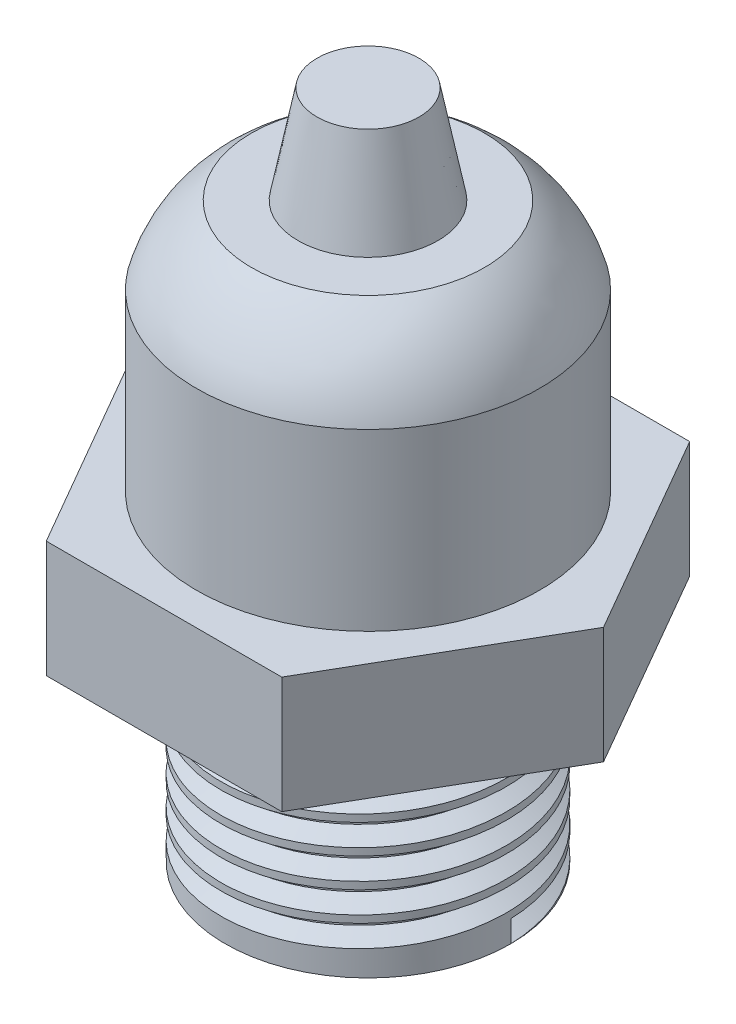
from build123d import *

# Parameters (mm, degrees)
BOSS_EXTRUDE1_DEPTH = 4
SKETCH4_R           = 4.9
SKETCH4_R_2         = 3.55
BOSS_EXTRUDE3_DEPTH = 7
THREAD1_PITCH       = 1
SKETCH8_R           = 1
BOSS_EXTRUDE4_DEPTH = 7


with BuildPart() as part:
    # Sketch1 → Boss-Extrude1 (new body)
    with BuildSketch(Plane(origin=(0, 0, 0), x_dir=(1, 0, 0), z_dir=(0, 1, 0))):
        Polygon((8.082903769, 0), (4.041451884, 7), (-4.041451884, 7), (-8.082903769, 0), (-4.041451884, -7), (4.041451884, -7), align=None)
    extrude(amount=BOSS_EXTRUDE1_DEPTH)

    # Sketch3 → Revolve1 (revolve)
    with BuildSketch(Plane.XY, mode=Mode.PRIVATE) as revolve1_sk:
        with BuildLine():
            ThreePointArc((4, 12.65), (5.177711742, 11.491642561), (5.8875, 10))
            Line((5.8875, 10), (5.8875, 4))
            Line((5.8875, 4), (0, 4))
            Line((0, 4), (0, 16))
            Line((0, 16), (1.75, 16))
            Line((1.75, 16), (2.4, 12.65))
            Line((2.4, 12.65), (4, 12.65))
        make_face()
    revolve(revolve1_sk.sketch.rotate(Axis((0, 16, 0), (0, -1, 0)), 180), axis=Axis((0, 16, 0), (0, -1, 0)))

    # Sketch4 → Boss-Extrude3 (add)
    with BuildSketch(Plane.XZ):
        with Locations(Location((0, 0, 0), (0, 0, 90))):
            Circle(SKETCH4_R)
        with Locations(Location((0, 0, 0), (0, 0, 270))):
            Circle(SKETCH4_R_2, mode=Mode.SUBTRACT)
    extrude(amount=BOSS_EXTRUDE3_DEPTH)

    # Thread1: the profile of Thread Profile1 profile screwed along a right-hand helix of 7 turns, 8 arcs to a turn; built about Z, then put on its axis
    thread1_z = Axis((0, 0, 0), (0, 0, 1))
    thread1_corners = [(4.9003, 0, -0.000173205), (4.358734125, 0, 0.312499999), (4.358734125, 0, 0.437499999), (4.9003, 0, 0.750173202)]
    with BuildLine(mode=Mode.PRIVATE) as thread1_profile:
        Line(thread1_corners[0], thread1_corners[1])
        Line(thread1_corners[1], thread1_corners[2])
        Line(thread1_corners[2], thread1_corners[3])
        Line(thread1_corners[3], thread1_corners[0])
    thread1_cap = Face(thread1_profile.wire())
    thread1_turn_angles = [0, 22.5, 45, 67.5, 90, 112.5, 135, 157.5, 180, 202.5, 225, 247.5, 270, 292.5, 315, 337.5, 360]
    thread1_turn_weights = [1, 0.9238795325112867, 1, 0.9238795325112867, 1, 0.9238795325112867, 1, 0.9238795325112867, 1, 0.9238795325112867, 1, 0.9238795325112867, 1, 0.9238795325112867, 1, 0.9238795325112867, 1]
    thread1_turn_rails = [Edge.make_bspline([Vector(p[0], p[1], 0).rotate(thread1_z, thread1_turn_angles[k]) / thread1_turn_weights[k] + Vector(0, 0, p[2] + THREAD1_PITCH * thread1_turn_angles[k] / 360) for k in range(17)], [0, 0, 0, 1, 1, 2, 2, 3, 3, 4, 4, 5, 5, 6, 6, 7, 7, 8, 8, 8], 2, thread1_turn_weights) for p in thread1_corners]
    thread1_turn_sides = [Face.make_surface_from_curves(thread1_turn_rails[p[0]], thread1_turn_rails[p[1]]) for p in [(0, 1), (1, 2), (2, 3), (3, 0)]]
    thread1 = Plane(origin=(0, -7, 0), x_dir=(1, 0, 0), z_dir=(0, 1, 0)) * Solid(Shell([*[p.moved(Location((0, 0, THREAD1_PITCH * i))) for i in range(7) for p in thread1_turn_sides], thread1_cap, thread1_cap.rotate(thread1_z, 2520).moved(Location((0, 0, THREAD1_PITCH * 2520 / 360)))]))
    add(thread1, mode=Mode.SUBTRACT)

    # Sketch8 → Boss-Extrude4 (add)
    with BuildSketch(Plane.XZ):
        with Locations(Location((0, 0, 0), (0, 0, 90))):
            Circle(SKETCH8_R)
    extrude(amount=BOSS_EXTRUDE4_DEPTH)


solid = part.part
